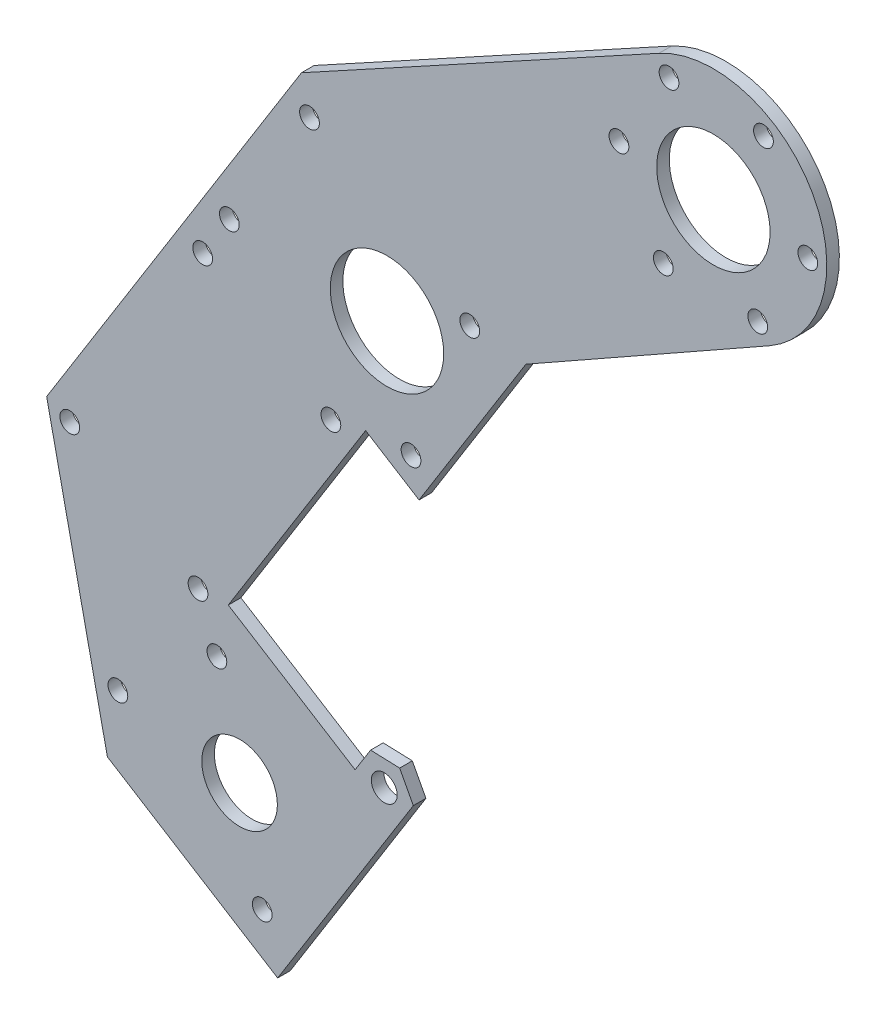
from build123d import *

# Parameters (mm, degrees)
SKETCH1_R               = 14.2875
SKETCH1_R_2             = 9.525
BOSS_EXTRUDE1_DEPTH     = 3.175
F_10_CLEARANCE_HOLE2_D  = 4.9784
F_10_CLEARANCE_HOLE3_D  = 4.9784
F_1_4_CLEARANCE_HOLE1_D = 6.5278


with BuildPart() as part:
    # Sketch1 → Boss-Extrude1 (new body)
    with BuildSketch(Plane.XY.offset(-14.194599474)):
        with BuildLine():
            Line((-11.403602879, 461.040918113), (18.881283072, 509.506866808))
            Line((18.881283072, 509.506866808), (22.784668372, 515.753589084))
            Line((22.784668372, 515.753589084), (19.342339301, 522.227668471))
            Line((19.342339301, 522.227668471), (12.014457551, 522.48356374))
            Line((12.014457551, 522.48356374), (8.11107225, 516.236841464))
            Line((8.11107225, 516.236841464), (-23.846467356, 536.206128526))
            Line((-23.846467356, 536.206128526), (10.759214603, 591.586796266))
            Line((10.759214603, 591.586796266), (24.22197813, 583.174327946))
            Line((24.22197813, 583.174327946), (51.141876753, 626.255171231))
            Line((51.141876753, 626.255171231), (112.462044501, 660.93728694))
            ThreePointArc((112.462044501, 660.93728694), (123.365099157, 699.702028842), (84.677956887, 710.877306848))
            Line((84.677956887, 710.877306848), (-5.401730059, 661.587538174))
            Line((-5.401730059, 661.587538174), (-69.615486106, 558.824047132))
            Line((-69.615486106, 558.824047132), (-54.307899735, 487.850498283))
            Line((-54.307899735, 487.850498283), (-11.403602879, 461.040918113))
        make_face()
        with Locations((16.14150623, 618.174698631)):
            Circle(SKETCH1_R, mode=Mode.SUBTRACT)
        with Locations((98.394472266, 685.809641802)):
            Circle(SKETCH1_R, mode=Mode.SUBTRACT)
        with Locations((-21.000382179, 498.8204658)):
            Circle(SKETCH1_R_2, mode=Mode.SUBTRACT)
    extrude(amount=BOSS_EXTRUDE1_DEPTH)

    # #10 Clearance Hole2 (through all)
    with Locations(Plane.XY.offset(-11.019599474)):
        with Locations((-26.71413896, 523.569465445), (-15.286625399, 474.071466154), (-3.381611976, 652.837445435), (37.006678604, 627.600040476), (22.201860047, 591.924420685), (-23.571535943, 620.526812972), (-31.474844299, 535.981130963), (-63.785476762, 556.17105493), (-51.664768266, 503.670498499), (2.009121865, 589.566678183), (-30.301510599, 609.756602151)):
            Hole(F_10_CLEARANCE_HOLE2_D / 2)

    # #10 Clearance Hole3 (through all)
    with Locations(Plane.XY.offset(-11.019599474)):
        with Locations((111.013174746, 706.003787092), (122.192466334, 684.978597537), (109.573763855, 664.784452247), (85.775769787, 665.615496512), (74.596478198, 686.640686067), (87.215180677, 706.834831357)):
            Hole(F_10_CLEARANCE_HOLE3_D / 2)

    # 1/4 Clearance Hole1 (through all)
    with Locations(Plane.XY.offset(-11.019599474)):
        with Locations((15.456786622, 516.009484354)):
            Hole(F_1_4_CLEARANCE_HOLE1_D / 2)


solid = part.part
